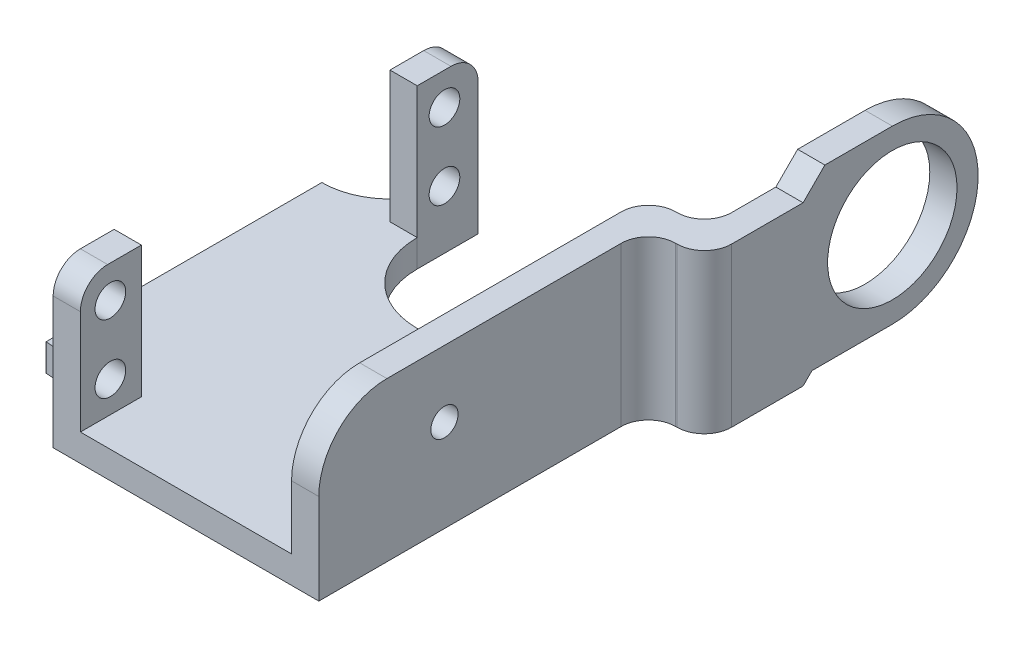
from build123d import *

# Parameters (mm, degrees)
BOSS_EXTRUDE1_DEPTH = 4
SKETCH2_W           = 8.95
SKETCH2_H           = 19.3
SKETCH2_R           = 2.25
BOSS_EXTRUDE2_DEPTH = 4
FILLET1_R           = 10
FILLET2_R           = 4
SKETCH3_W           = 52.4
SKETCH3_H           = 19.3
SKETCH3_R           = 2
BOSS_EXTRUDE3_DEPTH = 4
FILLET3_R           = 10
SKETCH4_W           = 31
SKETCH4_H           = 20.5
CUT_EXTRUDE1_DEPTH  = 10
SKETCH5_W           = 4
SKETCH5_H           = 6
CUT_EXTRUDE2_DEPTH  = 10
FILLET4_R           = 11.55
SKETCH6_W           = 4.2
SKETCH6_H           = 4
BOSS_EXTRUDE4_DEPTH = 23.3
SKETCH7_R           = 9.5
BOSS_EXTRUDE5_DEPTH = 4
FILLET6_R           = 4


with BuildPart() as part:
    # Sketch1 → Boss-Extrude1 (new body)
    with BuildSketch(Plane(origin=(0, 0, 0), x_dir=(1, 0, 0), z_dir=(0, 1, 0))):
        Polygon((-49, 49.45), (-39, 49.45), (-39, 58.4), (0, 58.4), (0, 0), (-39, 0), (-39, 8.95), (-49, 8.95), align=None)
    extrude(amount=BOSS_EXTRUDE1_DEPTH)

    # Sketch2 → Boss-Extrude2 (add)
    # profile 1 of 2: a face of its own
    with BuildSketch(Plane.ZY.offset(39)):
        with Locations((-4.475, 13.65)):
            Rectangle(SKETCH2_W, SKETCH2_H)
        with Locations((-4.4, 18.55)):
            Circle(SKETCH2_R, mode=Mode.SUBTRACT)
        with Locations((-4.4, 8.55)):
            Circle(SKETCH2_R, mode=Mode.SUBTRACT)
    # profile 2 of 2: a face of its own
    with BuildSketch(Plane.ZY.offset(39)):
        with Locations((-53.925, 13.65)):
            Rectangle(SKETCH2_W, SKETCH2_H)
        with Locations((-53.45, 18.55)):
            Circle(SKETCH2_R, mode=Mode.SUBTRACT)
        with Locations((-53.45, 8.55)):
            Circle(SKETCH2_R, mode=Mode.SUBTRACT)
    extrude(amount=-BOSS_EXTRUDE2_DEPTH)

    # Fillet1
    # the kernel refuses this fillet: 10 mm, written as the material it adds along each edge
    with BuildSketch(Plane(origin=(-39, 0, -49.45), x_dir=(-1, 0, 0), z_dir=(0, 1, 0))) as fillet1_piece_1:
        with BuildLine():
            CenterArc((9.944722218, -10), FILLET1_R, 90, 83.97283344)
            Line((0, -8.95), (0, 0))
            Line((0, 0), (9.944722218, 0))
        make_face()
    extrude(amount=4)
    with BuildSketch(Plane(origin=(-39, 0, -8.95), x_dir=(0, 0, 1), z_dir=(0, 1, 0))) as fillet1_piece_2:
        with BuildLine():
            CenterArc((10, -9.944722218), FILLET1_R, 96.02716656, 83.97283344)
            Line((0, -9.944722218), (0, 0))
            Line((0, 0), (8.95, 0))
        make_face()
    extrude(amount=4)

    # Fillet2
    fillet2_edges = [part.edges().sort_by_distance(p)[0] for p in [
        (-37, 23.3, 0),
        (-37, 23.3, -58.4),
    ]]
    fillet(fillet2_edges, radius=FILLET2_R)

    # Sketch3 → Boss-Extrude3 (add)
    with BuildSketch(Plane(origin=(0, 0, 0), x_dir=(0, 0, -1), z_dir=(1, 0, 0))):
        with Locations((26.2, 13.65)):
            Rectangle(SKETCH3_W, SKETCH3_H)
        with Locations((18.45, 13.55)):
            Circle(SKETCH3_R, mode=Mode.SUBTRACT)
    extrude(amount=-BOSS_EXTRUDE3_DEPTH)

    # Fillet3
    fillet3_edges = [part.edges().sort_by_distance(p)[0] for p in [
        (-2, 23.3, 0),
    ]]
    fillet(fillet3_edges, radius=FILLET3_R)

    # Sketch4 → Cut-Extrude1 (cut)
    with BuildSketch(Plane(origin=(0, 4, 0), x_dir=(1, 0, 0), z_dir=(0, 1, 0))):
        with Locations((-19.5, 48.15)):
            Rectangle(SKETCH4_W, SKETCH4_H)
    extrude(amount=-CUT_EXTRUDE1_DEPTH, mode=Mode.SUBTRACT)

    # Sketch5 → Cut-Extrude2 (cut)
    with BuildSketch(Plane(origin=(0, 4, 0), x_dir=(1, 0, 0), z_dir=(0, 1, 0))):
        with Locations((-2, 55.4)):
            Rectangle(SKETCH5_W, SKETCH5_H)
    extrude(amount=-CUT_EXTRUDE2_DEPTH, mode=Mode.SUBTRACT)

    # Fillet4
    fillet4_edges = [part.edges().sort_by_distance(p)[0] for p in [
        (-35, 2, -37.9),
    ]]
    fillet(fillet4_edges, radius=FILLET4_R)

    # Sketch6 → Boss-Extrude4 (add)
    with BuildSketch(Plane.XZ):
        with Locations((2.1, -50.4)):
            Rectangle(SKETCH6_W, SKETCH6_H)
    extrude(amount=-BOSS_EXTRUDE4_DEPTH)

    # Sketch7 → Boss-Extrude5 (add)
    with BuildSketch(Plane(origin=(4.2, 0, 0), x_dir=(0, 0, -1), z_dir=(1, 0, 0))):
        with BuildLine():
            Line((48.4, 0), (48.4, 23.3))
            Line((48.4, 23.3), (62.9, 23.3))
            Line((62.9, 23.3), (66.1, 26.5))
            Line((66.1, 26.5), (76, 26.5))
            ThreePointArc((76, 26.5), (88.6, 13.9), (76, 1.3))
            Line((76, 1.3), (64.2, 1.3))
            Line((64.2, 1.3), (62.9, 0))
            Line((62.9, 0), (48.4, 0))
        make_face()
        with Locations((76, 13.9)):
            Circle(SKETCH7_R, mode=Mode.SUBTRACT)
    extrude(amount=BOSS_EXTRUDE5_DEPTH)

    # Fillet6
    fillet6_edges = [part.edges().sort_by_distance(p)[0] for p in [
        (4.2, 11.65, -52.4),
        (0, 11.65, -48.4),
        (8.2, 11.65, -48.4),
        (-4, 11.65, -52.4),
    ]]
    fillet(fillet6_edges, radius=FILLET6_R)


solid = part.part
